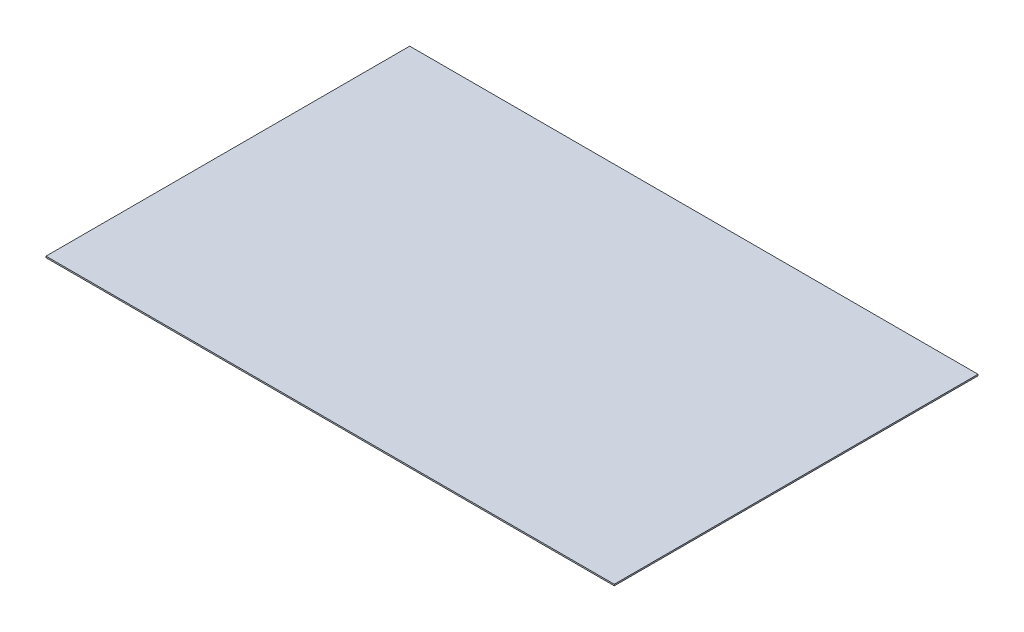
from build123d import *

# Parameters (mm, degrees)
SKETCH1_W           = 400
SKETCH1_H           = 256
BOSS_EXTRUDE1_DEPTH = 1


with BuildPart() as part:
    # Sketch1 → Boss-Extrude1 (new body)
    with BuildSketch(Plane(origin=(0, 0, 0), x_dir=(1, 0, 0), z_dir=(0, 1, 0))):
        Rectangle(SKETCH1_W, SKETCH1_H)
    extrude(amount=BOSS_EXTRUDE1_DEPTH)


solid = part.part
